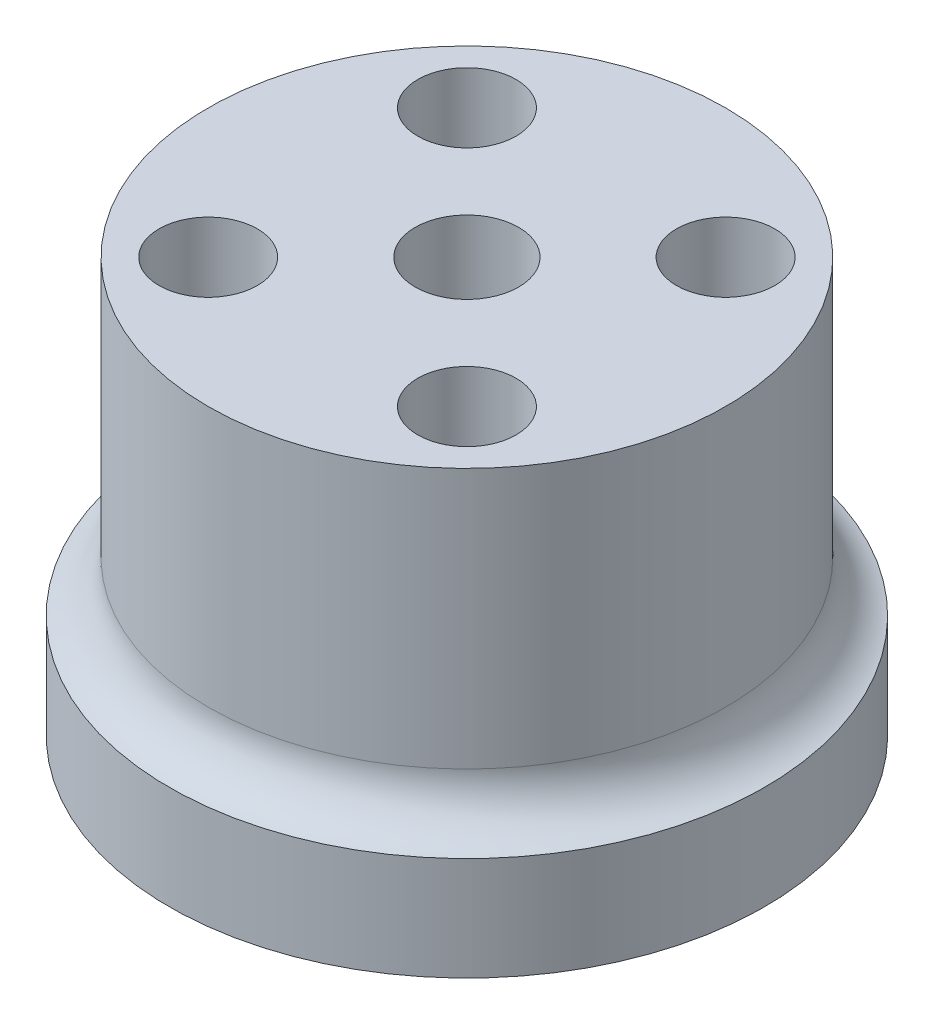
from build123d import *

# Parameters (mm, degrees)
SKETCH_1_R          = 10
SKETCH_1_R_2        = 1.9
SKETCH_1_R_3        = 2
EXTRUDE_6_DEPTH     = 20
SKETCH_12_R         = 11.5
SKETCH_12_R_2       = 3.1
EXTRUDE_8_DEPTH     = 4
SKETCH_13_R         = 3
CUT_EXTRUDE_7_DEPTH = 2
FILLET_3_R          = 2
CUT_EXTRUDE_START   = -4
SKETCH_14_R         = 10
CUT_EXTRUDE_8_DEPTH = 4
SKETCH_15_R         = 3.25
CUT_EXTRUDE_9_DEPTH = 3


with BuildPart() as part:
    # 草图1 → 凸台-拉伸6 (new body)
    with BuildSketch(Plane(origin=(0, 0, 0), x_dir=(1, 0, 0), z_dir=(0, 1, 0))):
        with Locations(Location((0, 0, 0), (0, 0, 270))):
            Circle(SKETCH_1_R)
        with Locations(Location((-5, 5, 0), (0, 0, 270))):
            Circle(SKETCH_1_R_2, mode=Mode.SUBTRACT)
        with Locations(Location((5, 5, 0), (0, 0, 270))):
            Circle(SKETCH_1_R_2, mode=Mode.SUBTRACT)
        with Locations(Location((5, -5, 0), (0, 0, 270))):
            Circle(SKETCH_1_R_2, mode=Mode.SUBTRACT)
        with Locations(Location((-5, -5, 0), (0, 0, 270))):
            Circle(SKETCH_1_R_2, mode=Mode.SUBTRACT)
        with Locations(Location((0, 0, 0), (0, 0, 270))):
            Circle(SKETCH_1_R_3, mode=Mode.SUBTRACT)
    extrude(amount=EXTRUDE_6_DEPTH)

    # 草图12 → 凸台-拉伸8 (add)
    with BuildSketch(Plane.XZ):
        with Locations(Location((0, 0, 0), (0, 0, 270))):
            Circle(SKETCH_12_R)
        Circle(SKETCH_12_R_2, mode=Mode.SUBTRACT)
    extrude(amount=-EXTRUDE_8_DEPTH)

    # 草图13 → 切除-拉伸7 (cut)
    with BuildSketch(Plane.XZ):
        with Locations(Location((0, 0, 0), (0, 0, 270))):
            Circle(SKETCH_13_R)
    extrude(amount=-CUT_EXTRUDE_7_DEPTH, mode=Mode.SUBTRACT)

    # 圆角3
    # the kernel refuses this fillet: 2 mm, written as the material it adds along each edge
    with BuildSketch(Plane(origin=(0, 4, 0), x_dir=(0, 0, 1), z_dir=(1, 0, 0))) as fillet_3_piece_1:
        with BuildLine():
            CenterArc((12, -1.936491673), FILLET_3_R, 104.477512186, 75.522487814)
            Line((10, -1.936491673), (9.96, -1.936491673))
            Line((9.96, -1.936491673), (9.96, 0))
            Line((9.96, 0), (10, 0.04))
            ThreePointArc((10, 0.04), (10.75, 0.04), (11.49, 0.038729833))
            Line((11.49, 0.038729833), (11.5, 0))
        make_face()
    revolve(axis=Axis((0, 4, 0), (0, -1, 0)))

    # 草图14 → 切除-拉伸8 (cut)
    with BuildSketch(Plane(origin=(0, 20, 0), x_dir=(1, 0, 0), z_dir=(0, 1, 0)).offset(CUT_EXTRUDE_START)):
        with Locations(Location((0, 0, 0), (0, 0, 90))):
            Circle(SKETCH_14_R)
    extrude(amount=CUT_EXTRUDE_8_DEPTH, mode=Mode.SUBTRACT)

    # 草图15 → 切除-拉伸9 (cut)
    with BuildSketch(Plane.XZ):
        with Locations(Location((0, 0, 0), (0, 0, 270))):
            Circle(SKETCH_15_R)
    extrude(amount=-CUT_EXTRUDE_9_DEPTH, mode=Mode.SUBTRACT)


solid = part.part
